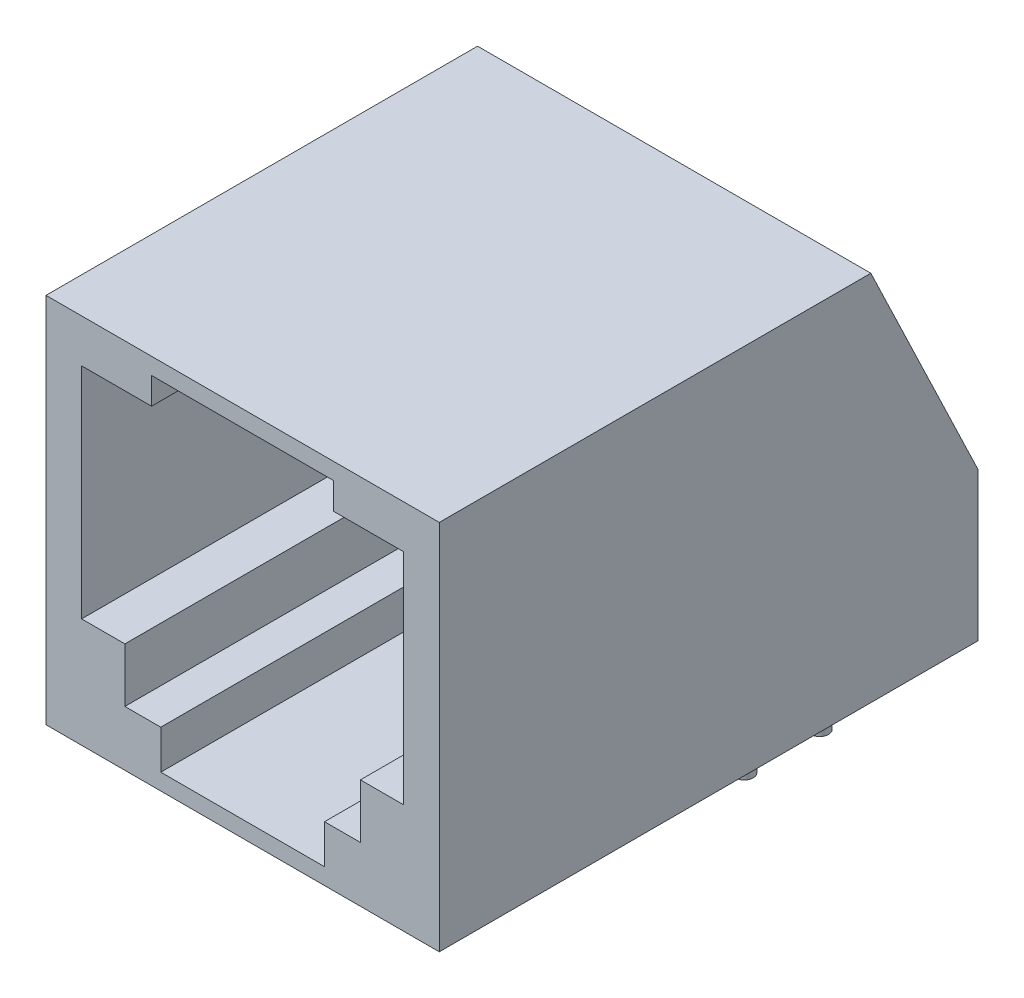
from build123d import *

# Parameters (mm, degrees)
BOSS_EXTRUDE1_DEPTH = 6.625
CUT_EXTRUDE1_DEPTH  = 13.25
SKETCH3_R           = 0.3
BOSS_EXTRUDE2_DEPTH = 4


with BuildPart() as part:
    # Sketch1 → Boss-Extrude1 (new, symmetric)
    with BuildSketch(Plane(origin=(0, 0, 0), x_dir=(0, 0, -1), z_dir=(1, 0, 0))):
        Polygon((0, 0), (0, 12.53), (14.54, 12.53), (18.15, 5), (18.15, 0), align=None)
    extrude(amount=BOSS_EXTRUDE1_DEPTH, both=True)

    # Sketch2 → Cut-Extrude1 (cut)
    with BuildSketch(Plane.XY):
        Polygon((-2.758412662, 1.863268477), (-2.758412662, 0.55), (2.758412662, 0.55), (2.758412662, 1.863268477), (3.967697722, 1.863268477), (3.967697722, 3.689249531), (5.425, 3.689249531), (5.425, 11.073209492), (3.069315997, 11.073209492), (3.069315997, 11.97), (-3.069315997, 11.97), (-3.069315997, 11.073209492), (-5.425, 11.073209492), (-5.425, 3.689249531), (-3.967697722, 3.689249531), (-3.967697722, 1.863268477), align=None)
    extrude(amount=-CUT_EXTRUDE1_DEPTH, mode=Mode.SUBTRACT)

    # Sketch3 → Boss-Extrude2 (add)
    with BuildSketch(Plane.XZ):
        with Locations((2.54, -16.9)):
            Circle(SKETCH3_R)
        with Locations((0, -16.9)):
            Circle(SKETCH3_R)
        with Locations((-2.54, -16.9)):
            Circle(SKETCH3_R)
        with Locations((0, -14.36)):
            Circle(SKETCH3_R)
        with Locations((-2.54, -14.36)):
            Circle(SKETCH3_R)
        with Locations((2.54, -14.36)):
            Circle(SKETCH3_R)
    extrude(amount=BOSS_EXTRUDE2_DEPTH)


solid = part.part
